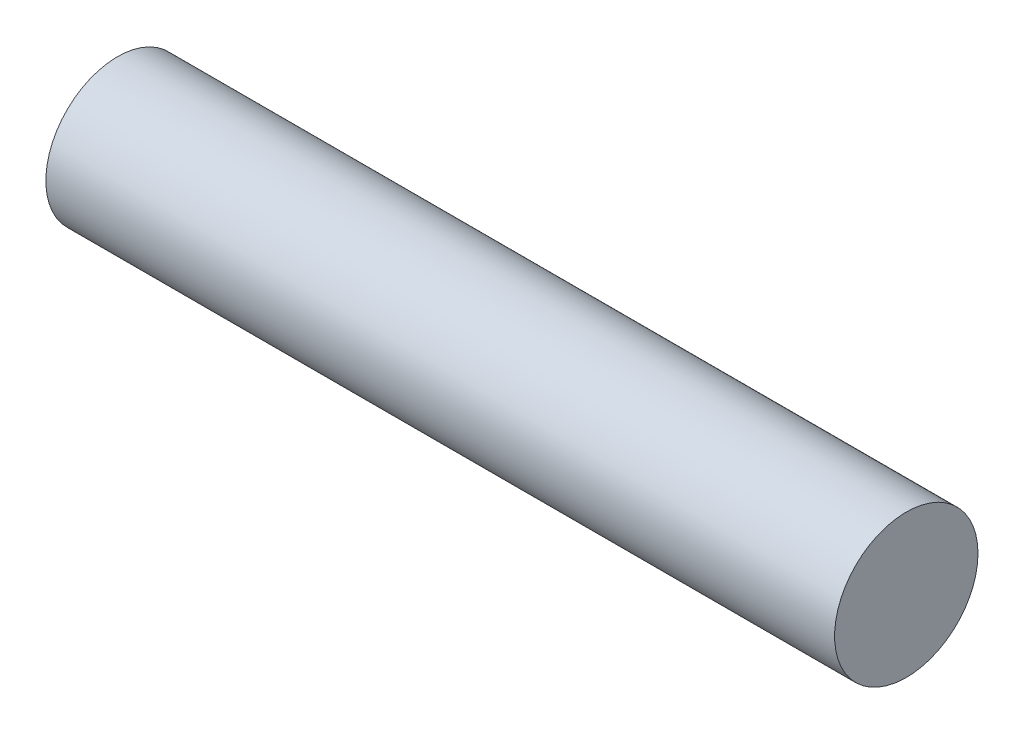
from build123d import *

# Parameters (mm, degrees)
SKETCH2_R           = 1
BOSS_EXTRUDE1_DEPTH = 11


with BuildPart() as part:
    # Sketch2 → Boss-Extrude1 (new body)
    with BuildSketch(Plane(origin=(0, 0, 0), x_dir=(0, 0, -1), z_dir=(1, 0, 0))):
        Circle(SKETCH2_R)
    extrude(amount=BOSS_EXTRUDE1_DEPTH)


solid = part.part
